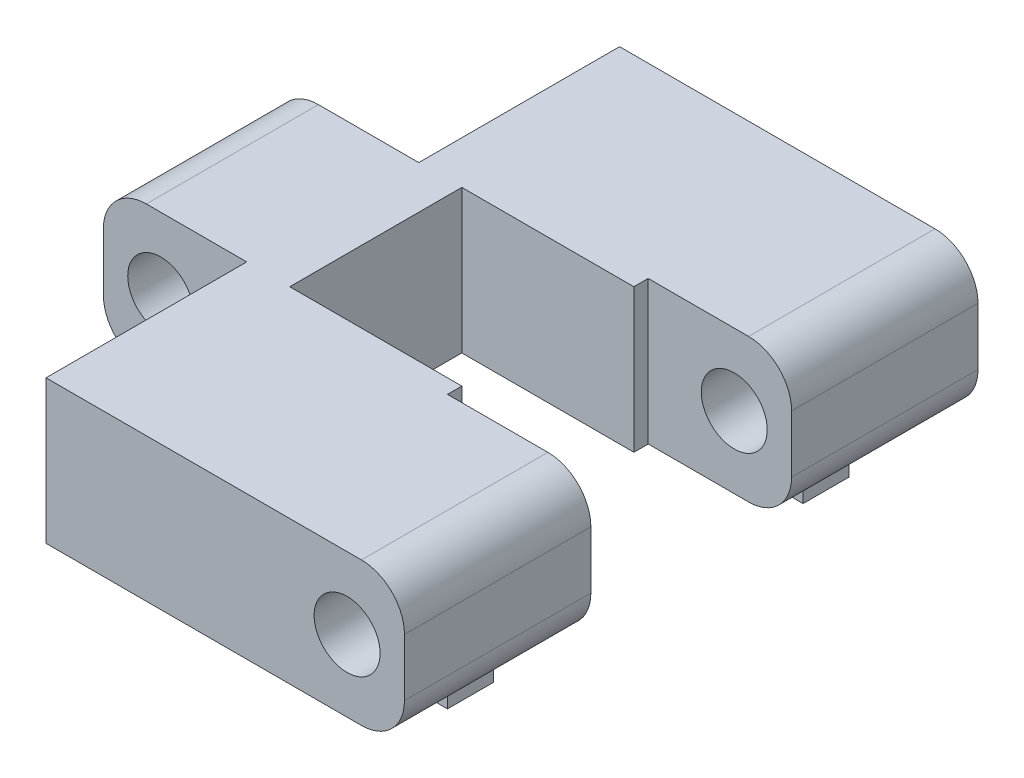
from build123d import *

# Parameters (mm, degrees)
SKETCH3_W           = 17.5
SKETCH3_H           = 20
BOSS_EXTRUDE1_DEPTH = 5
SKETCH4_R           = 1.15
CUT_EXTRUDE2_DEPTH  = 50
SKETCH5_W           = 5
SKETCH5_H           = 7
CUT_EXTRUDE3_DEPTH  = 20
FILLET1_R           = 1.5
FILLET3_R           = 1.5
SKETCH6_W           = 11
SKETCH6_H           = 1.6
BOSS_EXTRUDE2_DEPTH = 1


with BuildPart() as part:
    # Sketch3 → Boss-Extrude1 (new body)
    with BuildSketch(Plane(origin=(0, 0, 0), x_dir=(1, 0, 0), z_dir=(0, 1, 0))):
        Rectangle(SKETCH3_W, SKETCH3_H)
    extrude(amount=BOSS_EXTRUDE1_DEPTH)

    # Sketch4 → Cut-Extrude2 (cut)
    with BuildSketch(Plane.XY.offset(10)):
        with Locations((-6.75, 2.5)):
            Circle(SKETCH4_R)
        with Locations((6.75, 2.5)):
            Circle(SKETCH4_R)
    extrude(amount=-CUT_EXTRUDE2_DEPTH, mode=Mode.SUBTRACT)

    # Sketch5 → Cut-Extrude3 (cut)
    with BuildSketch(Plane(origin=(0, 5, 0), x_dir=(1, 0, 0), z_dir=(0, 1, 0))):
        Polygon((8.75, 3.5), (3.75, 3.5), (3.75, 3), (-2.25, 3), (-2.25, -3), (3.75, -3), (3.75, -3.5), (8.75, -3.5), align=None)
        with Locations((-6.25, 6.5)):
            Rectangle(SKETCH5_W, SKETCH5_H)
        with Locations((-6.25, -6.5)):
            Rectangle(SKETCH5_W, SKETCH5_H)
    extrude(amount=-CUT_EXTRUDE3_DEPTH, mode=Mode.SUBTRACT)

    # Fillet1
    fillet1_edges = [part.edges().sort_by_distance(p)[0] for p in [
        (-8.75, 0, 0),
        (-8.75, 5, 0),
    ]]
    fillet(fillet1_edges, radius=FILLET1_R)

    # Fillet3
    fillet3_edges = [part.edges().sort_by_distance(p)[0] for p in [
        (8.75, 5, -6.75),
        (8.75, 0, -6.75),
        (8.75, 0, 6.75),
        (8.75, 5, 6.75),
    ]]
    fillet(fillet3_edges, radius=FILLET3_R)

    # Sketch6 → Boss-Extrude2 (add)
    with BuildSketch(Plane.XZ):
        with Locations((1.75, -6.2)):
            Rectangle(SKETCH6_W, SKETCH6_H)
        with Locations((1.75, 6.2)):
            Rectangle(SKETCH6_W, SKETCH6_H)
    extrude(amount=BOSS_EXTRUDE2_DEPTH)


solid = part.part
